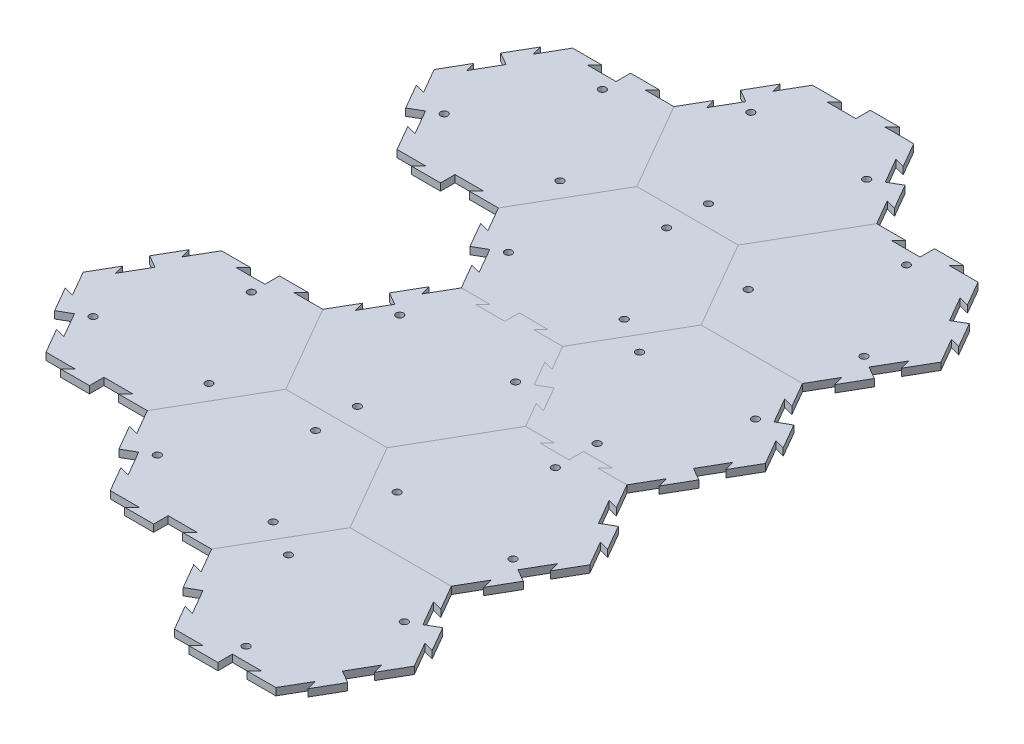
from build123d import *

# Parameters (mm, degrees)
BOSS_EXTRUDE1_DEPTH     = 6.35
SKETCH9_R               = 3.175
CUT_EXTRUDE3_DEPTH      = 118.774954893
CIRPATTERN6_COUNT       = 3
CUT_EXTRUDE2_DEPTH      = 271.453350876
BOSS_EXTRUDE3_DEPTH     = 6.35
CIRPATTERN3_COUNT       = 3
CIRPATTERN3_ANGLE       = 120
CIRPATTERN5_START       = -6.35
CIRPATTERN5_OUTLINE_R   = 3.175
CIRPATTERN5_DEPTH       = 6.35
CIRPATTERN5_2_OUTLINE_R = 3.175
CIRPATTERN5_2_DEPTH     = 6.35
CIRPATTERN5_3_OUTLINE_R = 3.175
CIRPATTERN5_3_DEPTH     = 6.35
BOSS_EXTRUDE4_DEPTH     = 6.35
CUT_EXTRUDE4_DEPTH      = 326.200985522
CIRPATTERN7_COUNT       = 2
CIRPATTERN7_ANGLE       = 60
CUT_EXTRUDE5_DEPTH      = 326.200985522
BOSS_EXTRUDE5_DEPTH     = 6.35
CUT_EXTRUDE6_DEPTH      = 326.200985522
BOSS_EXTRUDE6_DEPTH     = 6.35
LPATTERN1_COUNT         = 2
LPATTERN1_PITCH         = 307.958633764


# Read off the part's stored shape, not the designer's step: CirPattern5
with BuildPart() as part:
    # Sketch1 → Boss-Extrude1 (new body)
    with BuildSketch(Plane(origin=(0, 0, 0), x_dir=(1, 0, 0), z_dir=(0, 1, 0))):
        Polygon((88.9, 0), (44.45, 76.989658396), (-44.45, 76.989658396), (-88.9, 0), (-44.45, -76.989658396), (44.45, -76.989658396), align=None)
    extrude(amount=-BOSS_EXTRUDE1_DEPTH)

    # Sketch9 → Cut-Extrude3 (cut, through all)
    with BuildSketch(Plane(origin=(0, 0, 0), x_dir=(1, 0, 0), z_dir=(0, 1, 0))):
        with Locations(Location((-50.8, -29.329393675, 0), (0, 0, 270))):
            Circle(SKETCH9_R)
    cut_extrude3 = extrude(amount=-CUT_EXTRUDE3_DEPTH, mode=Mode.SUBTRACT)

    # CirPattern6: Cut-Extrude3 ×3 about axis
    cirpattern6_axis = Axis((0, 0, 0), (0, 1, 0))
    for i in range(1, CIRPATTERN6_COUNT):
        add(cut_extrude3.rotate(cirpattern6_axis, i * 360 / CIRPATTERN6_COUNT), mode=Mode.SUBTRACT)


with BuildPart() as body_2:
    # Mirror1: mirrored copy
    add(part.part.mirror(Plane(origin=(44.45, -6.35, 76.989658396), x_dir=(-0.49999999999999495, 0, 0.8660254037844416), z_dir=(0.8660254037844416, 0, 0.49999999999999495))))

    # Sketch5 → Cut-Extrude2 (cut, through all)
    with BuildSketch(Plane(origin=(0, 0, 0), x_dir=(1, 0, 0), z_dir=(0, 1, 0))):
        Polygon((190.5, -21.997045256), (181.825738686, -19.672783942), (194.525738686, -41.669829198), (200.025, -38.494829198), align=None)
    cut_extrude2 = extrude(amount=-CUT_EXTRUDE2_DEPTH, mode=Mode.SUBTRACT)

    # Sketch7 → Boss-Extrude3 (add)
    with BuildSketch(Plane(origin=(0, 0, 0), x_dir=(1, 0, 0), z_dir=(0, 1, 0))):
        Polygon((200.025, -38.494829198), (205.524261314, -35.319829198), (218.224261314, -57.316874454), (209.55, -54.99261314), align=None)
    boss_extrude3 = extrude(amount=-BOSS_EXTRUDE3_DEPTH)

    # CirPattern3: Cut-Extrude2, Boss-Extrude3 ×3 about axis
    cirpattern3_axis = Axis((133.35, 0, 76.989658396), (0, -1, 0))
    add([cut_extrude2.rotate(cirpattern3_axis, i * CIRPATTERN3_ANGLE / (CIRPATTERN3_COUNT - 1)) for i in range(1, CIRPATTERN3_COUNT)], mode=Mode.SUBTRACT)
    add([boss_extrude3.rotate(cirpattern3_axis, i * CIRPATTERN3_ANGLE / (CIRPATTERN3_COUNT - 1)) for i in range(1, CIRPATTERN3_COUNT)])

    # Sketch14 → Cut-Extrude6 (cut, through all)
    with BuildSketch(Plane(origin=(0, 0, 0), x_dir=(1, 0, 0), z_dir=(0, 1, 0))):
        Polygon((66.675, -115.484487595), (72.174261314, -112.309487595), (84.874261314, -134.306532851), (76.2, -131.982271537), align=None)
    extrude(amount=-CUT_EXTRUDE6_DEPTH, mode=Mode.SUBTRACT)

    # Sketch15 → Boss-Extrude6 (add)
    with BuildSketch(Plane(origin=(0, 0, 0), x_dir=(1, 0, 0), z_dir=(0, 1, 0))):
        Polygon((66.675, -115.484487595), (61.175738686, -118.659487595), (48.475738686, -96.662442339), (57.15, -98.986703653), align=None)
    extrude(amount=-BOSS_EXTRUDE6_DEPTH)


with BuildPart() as body_3:
    # CirPattern5 outline → CirPattern5 (new body)
    with BuildSketch(Plane(origin=(0, 0, 0), x_dir=(1, 0, 0), z_dir=(0, 1, 0)).offset(CIRPATTERN5_START)):
        Polygon((-44.45, 76.989658396), (-88.9, 153.979316793), (-114.3, 153.979316793), (-107.95, 160.329316793), (-133.35, 160.329316793), (-133.35, 147.629316793), (-158.75, 147.629316793), (-152.4, 153.979316793), (-177.8, 153.979316793), (-190.5, 131.982271537), (-192.824261314, 140.656532851), (-205.524261314, 118.659487595), (-194.525738686, 112.309487595), (-207.225738686, 90.312442339), (-209.55, 98.986703653), (-222.25, 76.989658396), (-209.55, 54.99261314), (-218.224261314, 57.316874454), (-205.524261314, 35.319829198), (-194.525738686, 41.669829198), (-181.825738686, 19.672783942), (-190.5, 21.997045256), (-177.8, 0), (-88.9, 0), align=None)
        with Locations((-184.15, 47.660264722)):
            Circle(CIRPATTERN5_OUTLINE_R, mode=Mode.SUBTRACT)
        with Locations((-82.55, 47.660264722)):
            Circle(CIRPATTERN5_OUTLINE_R, mode=Mode.SUBTRACT)
        with Locations((-133.35, 135.648445746)):
            Circle(CIRPATTERN5_OUTLINE_R, mode=Mode.SUBTRACT)
    extrude(amount=CIRPATTERN5_DEPTH)

    # Sketch12 → Cut-Extrude5 (cut, through all)
    with BuildSketch(Plane(origin=(0, 0, 0), x_dir=(1, 0, 0), z_dir=(0, 1, 0))):
        Polygon((-133.35, 0), (-133.35, 6.35), (-107.95, 6.35), (-114.3, 0), align=None)
    extrude(amount=-CUT_EXTRUDE5_DEPTH, mode=Mode.SUBTRACT)

    # Sketch13 → Boss-Extrude5 (add)
    with BuildSketch(Plane(origin=(0, 0, 0), x_dir=(1, 0, 0), z_dir=(0, 1, 0))):
        Polygon((-133.35, 0), (-133.35, -6.35), (-158.75, -6.35), (-152.4, 0), align=None)
    extrude(amount=-BOSS_EXTRUDE5_DEPTH)


with BuildPart() as body_4:
    # CirPattern5 2 outline → CirPattern5 2 (new body)
    with BuildSketch(Plane(origin=(0, 0, 0), x_dir=(1, 0, 0), z_dir=(0, 1, 0)).offset(CIRPATTERN5_START)):
        Polygon((44.45, 76.989658396), (88.9, 153.979316793), (76.2, 175.976362049), (84.874261314, 173.652100735), (72.174261314, 195.649145991), (61.175738686, 189.299145991), (48.475738686, 211.296191247), (57.15, 208.971929933), (44.45, 230.968975189), (19.05, 230.968975189), (25.4, 237.318975189), (0, 237.318975189), (0, 224.618975189), (-25.4, 224.618975189), (-19.05, 230.968975189), (-44.45, 230.968975189), (-57.15, 208.971929933), (-59.474261314, 217.646191247), (-72.174261314, 195.649145991), (-61.175738686, 189.299145991), (-73.875738686, 167.302100735), (-76.2, 175.976362049), (-88.9, 153.979316793), (-44.45, 76.989658396), align=None)
        with Locations((0, 95.320529443)):
            Circle(CIRPATTERN5_2_OUTLINE_R, mode=Mode.SUBTRACT)
        with Locations((-50.8, 183.308710468)):
            Circle(CIRPATTERN5_2_OUTLINE_R, mode=Mode.SUBTRACT)
        with Locations((50.8, 183.308710468)):
            Circle(CIRPATTERN5_2_OUTLINE_R, mode=Mode.SUBTRACT)
    extrude(amount=CIRPATTERN5_2_DEPTH)


with BuildPart() as body_5:
    # CirPattern5 3 outline → CirPattern5 3 (new body)
    with BuildSketch(Plane(origin=(0, 0, 0), x_dir=(1, 0, 0), z_dir=(0, 1, 0)).offset(CIRPATTERN5_START)):
        Polygon((88.9, 0), (177.8, 0), (190.5, 21.997045256), (192.824261314, 13.322783942), (205.524261314, 35.319829198), (194.525738686, 41.669829198), (207.225738686, 63.666874454), (209.55, 54.99261314), (222.25, 76.989658396), (209.55, 98.986703653), (218.224261314, 96.662442339), (205.524261314, 118.659487595), (194.525738686, 112.309487595), (181.825738686, 134.306532851), (190.5, 131.982271537), (177.8, 153.979316793), (152.4, 153.979316793), (158.75, 160.329316793), (133.35, 160.329316793), (133.35, 147.629316793), (107.95, 147.629316793), (114.3, 153.979316793), (88.9, 153.979316793), (44.45, 76.989658396), align=None)
        with Locations((82.55, 47.660264722)):
            Circle(CIRPATTERN5_3_OUTLINE_R, mode=Mode.SUBTRACT)
        with Locations((184.15, 47.660264722)):
            Circle(CIRPATTERN5_3_OUTLINE_R, mode=Mode.SUBTRACT)
        with Locations((133.35, 135.648445746)):
            Circle(CIRPATTERN5_3_OUTLINE_R, mode=Mode.SUBTRACT)
    extrude(amount=CIRPATTERN5_3_DEPTH)


with BuildPart() as part_1:
    add(part.part)

    # Sketch10 → Boss-Extrude4 (add)
    with BuildSketch(Plane(origin=(0, 0, 0), x_dir=(1, 0, 0), z_dir=(0, 1, 0))):
        Polygon((-76.2, -21.997045256), (-84.874261314, -19.672783942), (-72.174261314, -41.669829198), (-66.675, -38.494829198), align=None)
    boss_extrude4 = extrude(amount=-BOSS_EXTRUDE4_DEPTH)

    # Sketch11 → Cut-Extrude4 (cut, through all)
    with BuildSketch(Plane(origin=(0, 0, 0), x_dir=(1, 0, 0), z_dir=(0, 1, 0))):
        Polygon((-66.675, -38.494829198), (-61.175738686, -35.319829198), (-48.475738686, -57.316874454), (-57.15, -54.99261314), align=None)
    cut_extrude4 = extrude(amount=-CUT_EXTRUDE4_DEPTH, mode=Mode.SUBTRACT)

    # CirPattern7: Boss-Extrude4, Cut-Extrude4 ×2 about axis
    cirpattern7_axis = Axis((0, 0, 0), (0, 1, 0))
    add([boss_extrude4.rotate(cirpattern7_axis, i * CIRPATTERN7_ANGLE / (CIRPATTERN7_COUNT - 1)) for i in range(1, CIRPATTERN7_COUNT)])
    add([cut_extrude4.rotate(cirpattern7_axis, i * CIRPATTERN7_ANGLE / (CIRPATTERN7_COUNT - 1)) for i in range(1, CIRPATTERN7_COUNT)], mode=Mode.SUBTRACT)


with BuildPart() as lpattern1_1:
    # LPattern1: pattern copy
    add(body_2.part.moved(Location(Vector(0, 0, -1) * (1 * LPATTERN1_PITCH))))


with BuildPart() as lpattern1_2:
    # LPattern1: pattern copy
    add(part_1.part.moved(Location(Vector(0, 0, -1) * (1 * LPATTERN1_PITCH))))


with BuildPart() as lpattern1_3:
    # LPattern1: pattern copy
    add(body_3.part.moved(Location(Vector(0, 0, -1) * (1 * LPATTERN1_PITCH))))


with BuildPart() as lpattern1_4:
    # LPattern1: pattern copy
    add(body_5.part.moved(Location(Vector(0, 0, -1) * (1 * LPATTERN1_PITCH))))


with BuildPart() as lpattern1_5:
    # LPattern1: pattern copy
    add(body_4.part.moved(Location(Vector(0, 0, -1) * (1 * LPATTERN1_PITCH))))


solid = Compound([body_2.part, body_3.part, body_4.part, body_5.part, part_1.part, lpattern1_1.part, lpattern1_2.part, lpattern1_3.part, lpattern1_4.part, lpattern1_5.part])
